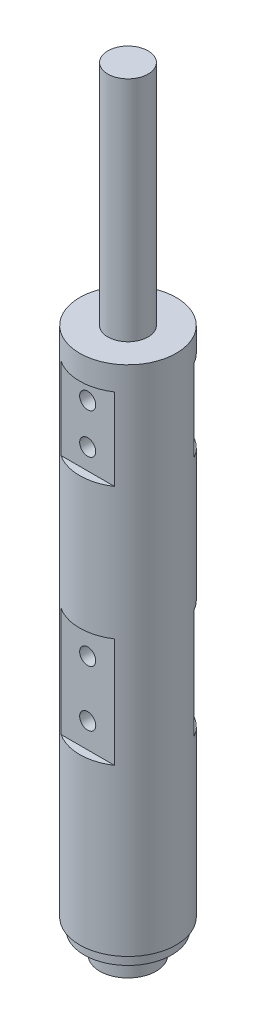
from build123d import *

# Parameters (mm, degrees)
SKETCH1_R               = 19.05
BOSS_EXTRUDE1_DEPTH     = 304.8
SKETCH2_W               = 11.1125
SKETCH2_H               = 89.789
CUT_EXTRUDE1_DEPTH      = 306.9883086
CUT_EXTRUDE1_DEPTH_BACK = 306.9883086
SKETCH3_W               = 9.525
SKETCH3_H               = 32.258
SKETCH3_H_2             = 43.18
SKETCH3_W_2             = 3.175
F_1_1_DIAMETER_HOLE1_D  = 6.35


with BuildPart() as part:
    # Sketch1 → Boss-Extrude1 (new body)
    with BuildSketch(Plane(origin=(0, 0, 0), x_dir=(1, 0, 0), z_dir=(0, 1, 0))):
        Circle(SKETCH1_R)
    extrude(amount=BOSS_EXTRUDE1_DEPTH)

    # Sketch2 → Cut-Revolve1 (revolve, cut)
    with BuildSketch(Plane.XY):
        Polygon((19.05, 0), (11.1125, 0), (11.1125, 8.636), (17.272, 8.636), (17.272, 12.954), (19.05, 12.954), align=None)
        with Locations((13.49375, 259.9055)):
            Rectangle(SKETCH2_W, SKETCH2_H)
    revolve(axis=Axis((0, 348.337253792, 0), (0, -1, 0)), mode=Mode.SUBTRACT)

    # Sketch3 → Cut-Extrude1 (cut, two sides: drawn at the far end of the back side and taken through both)
    with BuildSketch(Plane(origin=(0, 0, 0), x_dir=(0, 0, -1), z_dir=(1, 0, 0)).offset(-CUT_EXTRUDE1_DEPTH_BACK)):
        with Locations((14.2875, 189.357)):
            Rectangle(SKETCH3_W, SKETCH3_H)
        with Locations((14.2875, 99.568)):
            Rectangle(SKETCH3_W, SKETCH3_H_2)
        with Locations((-17.4625, 189.357)):
            Rectangle(SKETCH3_W_2, SKETCH3_H)
        with Locations((-17.4625, 99.568)):
            Rectangle(SKETCH3_W_2, SKETCH3_H_2)
    extrude(amount=CUT_EXTRUDE1_DEPTH + CUT_EXTRUDE1_DEPTH_BACK, mode=Mode.SUBTRACT)

    # 1 (1) Diameter Hole1 (through all)
    with Locations(Plane(origin=(0, 0, -9.525), x_dir=(-1, 0, 0), z_dir=(0, 0, -1))):
        with Locations((0, 197.2945), (0, 181.4195), (0, 109.982), (0, 87.884)):
            Hole(F_1_1_DIAMETER_HOLE1_D / 2)


solid = part.part
